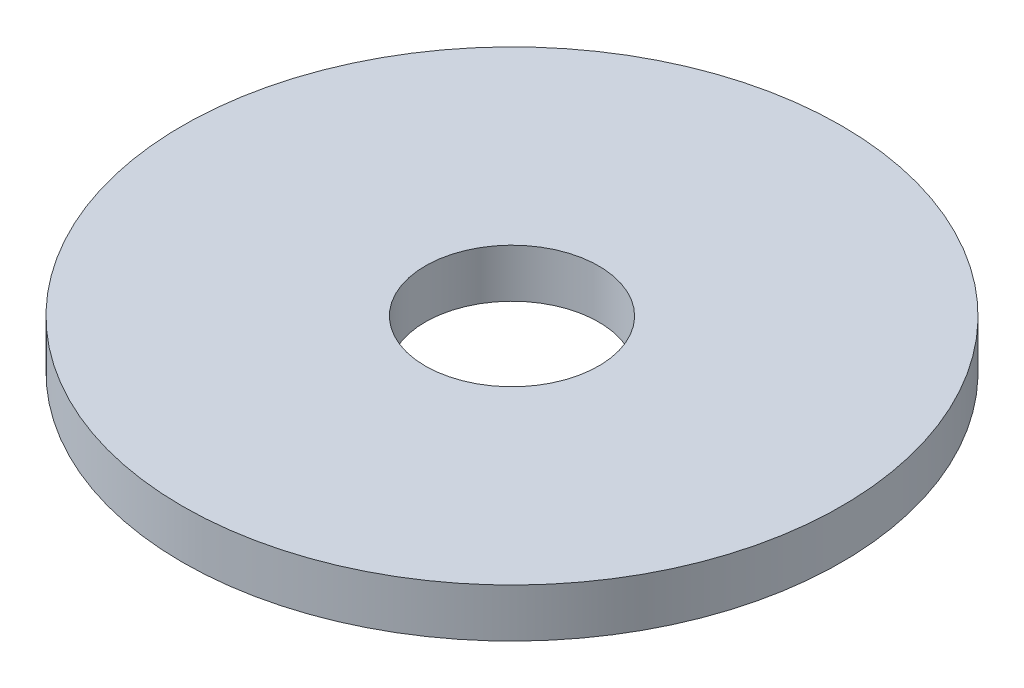
from build123d import *

# Parameters (mm, degrees)
SKETCH1_R           = 95
BOSS_EXTRUDE1_DEPTH = 14
SKETCH2_R           = 25
CUT_EXTRUDE1_DEPTH  = 136.077755386


with BuildPart() as part:
    # Sketch1 → Boss-Extrude1 (new body)
    with BuildSketch(Plane(origin=(0, 0, 0), x_dir=(1, 0, 0), z_dir=(0, 1, 0))):
        Circle(SKETCH1_R)
    extrude(amount=BOSS_EXTRUDE1_DEPTH)

    # Sketch2 → Cut-Extrude1 (cut, through all)
    with BuildSketch(Plane(origin=(0, 0, 0), x_dir=(1, 0, 0), z_dir=(0, 1, 0))):
        Circle(SKETCH2_R)
    extrude(amount=CUT_EXTRUDE1_DEPTH, mode=Mode.SUBTRACT)


solid = part.part
